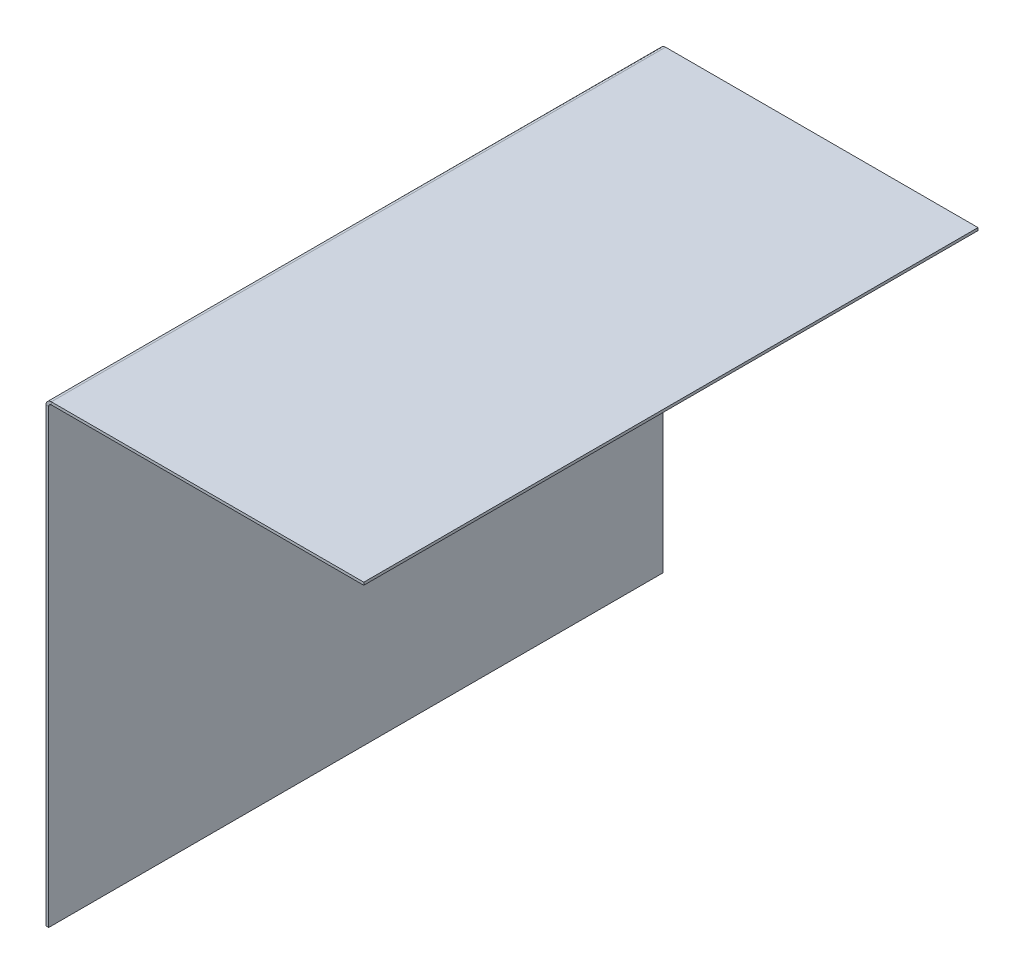
from build123d import *

# Parameters (mm, degrees)
BRIDA_BASE1_DEPTH = 115


# Sheet-metal steps are written as plain solids
with BuildPart() as part:
    # Croquis1 → Brida base1 (new, symmetric)
    with BuildSketch(Plane.XY):
        with BuildLine():
            Line((0, -170), (0, -1))
            ThreePointArc((0, -1), (0.292893219, -0.292893219), (1, 0))
            Line((1, 0), (118, 0))
            Line((118, 0), (118, 1))
            Line((118, 1), (1, 1))
            ThreePointArc((1, 1), (-0.414213562, 0.414213562), (-1, -1))
            Line((-1, -1), (-1, -170))
            Line((-1, -170), (0, -170))
        make_face()
    extrude(amount=BRIDA_BASE1_DEPTH, both=True)


solid = part.part
